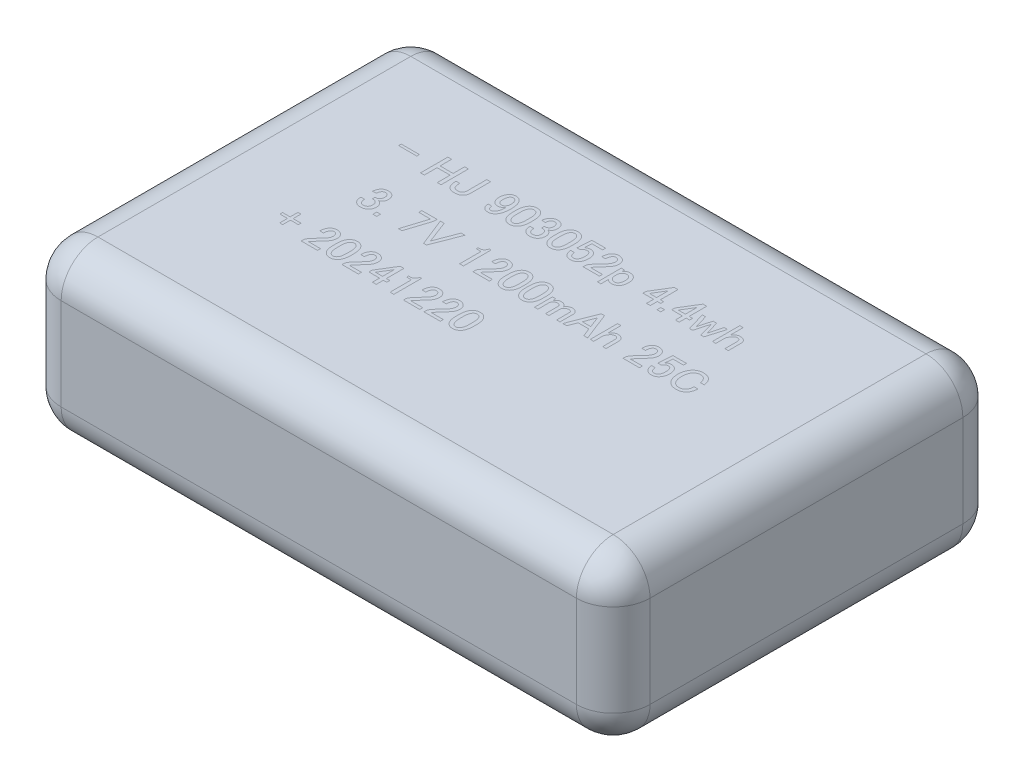
from build123d import *

# Parameters (mm, degrees)
SKETCH1_W           = 32
SKETCH1_H           = 21
BOSS_EXTRUDE1_DEPTH = 9
FILLET1_R           = 2


with BuildPart() as part:
    # Sketch1 → Boss-Extrude1 (new body)
    with BuildSketch(Plane(origin=(0, 0, 0), x_dir=(1, 0, 0), z_dir=(0, 1, 0))):
        with Locations((16, 10.5)):
            Rectangle(SKETCH1_W, SKETCH1_H)
    extrude(amount=BOSS_EXTRUDE1_DEPTH)

    # Fillet1
    fillet1_edges = [part.edges().sort_by_distance(p)[0] for p in [
        (32, 4.5, -21),
        (32, 4.5, 0),
        (0, 4.5, -21),
        (0, 4.5, 0),
        (16, 0, 0),
        (32, 0, -10.5),
        (16, 0, -21),
        (0, 0, -10.5),
        (16, 9, -21),
        (32, 9, -10.5),
        (16, 9, 0),
        (0, 9, -10.5),
    ]]
    fillet(fillet1_edges, radius=FILLET1_R)


solid = part.part
